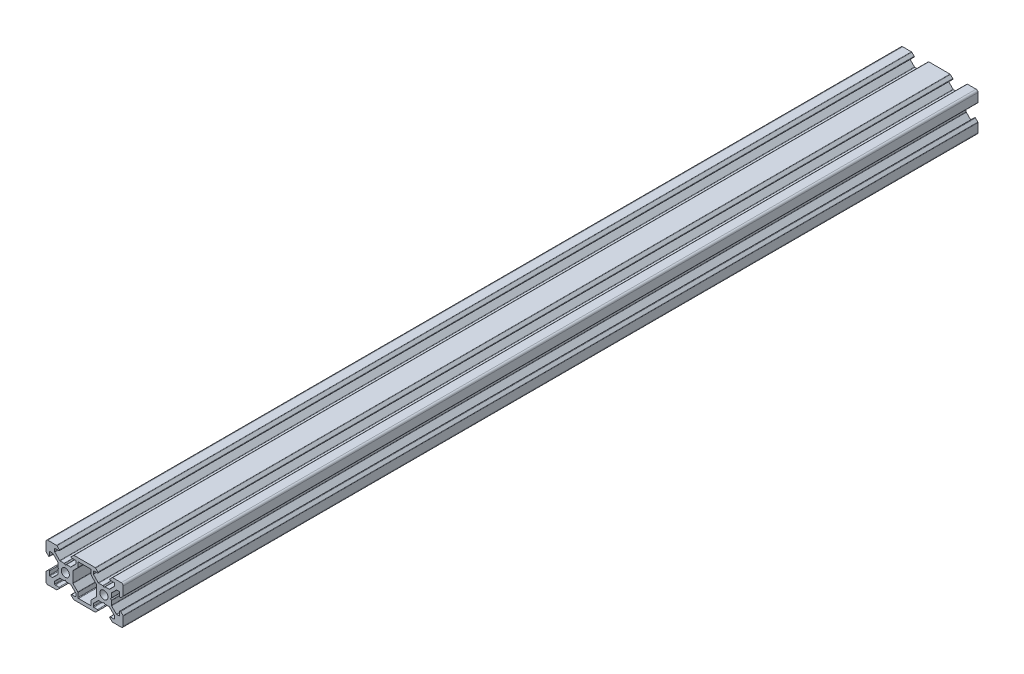
from build123d import *

# Parameters (mm, degrees)
SKETCH_1_R      = 2.1
EXTRUDE_1_DEPTH = 443
FILLET_1_R      = 1
FILLET_2_R      = 0.3


with BuildPart() as part:
    # Эскиз1 → Бобышка-Вытянуть1 (new body)
    with BuildSketch(Plane.XY):
        Polygon((-10, -10), (-10, -4.4), (-8.2, -2.6), (-8.2, -5.499339828), (-6.56, -5.499339828), (-3.900660172, -2.84), (-3.900660172, -0.5), (-3.400660172, 0), (-3.900660172, 0.5), (-3.900660172, 2.84), (-6.56, 5.499339828), (-8.2, 5.499339828), (-8.2, 2.6), (-10, 4.4), (-10, 10), (-4.4, 10), (-2.6, 8.2), (-5.499339828, 8.2), (-5.499339828, 6.56), (-2.84, 3.900660172), (-0.5, 3.900660172), (0, 3.400660172), (0.5, 3.900660172), (2.84, 3.900660172), (5.499339828, 6.56), (5.499339828, 8.2), (2.6, 8.2), (4.4, 10), (15.6, 10), (17.4, 8.2), (14.500660172, 8.2), (14.500660172, 6.56), (17.16, 3.900660172), (19.5, 3.900660172), (20, 3.400660172), (20.5, 3.900660172), (22.84, 3.900660172), (25.499339828, 6.56), (25.499339828, 8.2), (22.6, 8.2), (24.4, 10), (30, 10), (30, 4.4), (28.2, 2.6), (28.2, 5.499339828), (26.56, 5.499339828), (23.900660172, 2.84), (23.900660172, 0.5), (23.400660172, 0), (23.900660172, -0.5), (23.900660172, -2.84), (26.56, -5.499339828), (28.2, -5.499339828), (28.2, -2.6), (30, -4.4), (30, -10), (24.4, -10), (22.6, -8.2), (25.499339828, -8.2), (25.499339828, -6.56), (22.84, -3.900660172), (20.5, -3.900660172), (20, -3.400660172), (19.5, -3.900660172), (17.16, -3.900660172), (14.500660172, -6.56), (14.500660172, -8.2), (17.4, -8.2), (15.6, -10), (4.4, -10), (2.6, -8.2), (5.499339828, -8.2), (5.499339828, -6.56), (2.84, -3.900660172), (0.5, -3.900660172), (0, -3.400660172), (-0.5, -3.900660172), (-2.84, -3.900660172), (-5.499339828, -6.56), (-5.499339828, -8.2), (-2.6, -8.2), (-4.4, -10), align=None)
        Circle(SKETCH_1_R, mode=Mode.SUBTRACT)
        with Locations((20, 0)):
            Circle(SKETCH_1_R, mode=Mode.SUBTRACT)
        Polygon((3.900660172, -0.5), (3.900660172, 0.5), (3.900660172, 2.84), (6.56, 5.499339828), (6.56, 8.2), (13.44, 8.2), (13.44, 5.499339828), (16.099339828, 2.84), (16.099339828, 0.5), (16.099339828, -0.5), (16.099339828, -2.84), (13.44, -5.499339828), (13.44, -8.2), (6.56, -8.2), (6.56, -5.499339828), (3.900660172, -2.84), align=None, mode=Mode.SUBTRACT)
    extrude(amount=EXTRUDE_1_DEPTH)

    # Скругление1
    fillet_1_edges = [part.edges().sort_by_distance(p)[0] for p in [
        (-10, 10, 221.5),
        (-10, -10, 221.5),
        (30, 10, 221.5),
        (30, -10, 221.5),
    ]]
    fillet(fillet_1_edges, radius=FILLET_1_R)

    # Скругление2
    fillet_2_edges = [part.edges().sort_by_distance(p)[0] for p in [
        (-4.4, 10, 221.5),
        (-2.6, 8.2, 221.5),
        (-5.499339828, 8.2, 221.5),
        (-5.499339828, 6.56, 221.5),
        (-2.84, 3.900660172, 221.5),
        (-0.5, 3.900660172, 221.5),
        (0.5, 3.900660172, 221.5),
        (2.84, 3.900660172, 221.5),
        (5.499339828, 6.56, 221.5),
        (4.4, 10, 221.5),
        (5.499339828, 8.2, 221.5),
        (2.6, 8.2, 221.5),
        (3.900660172, 2.84, 221.5),
        (3.900660172, -2.84, 221.5),
        (4.4, -10, 221.5),
        (2.6, -8.2, 221.5),
        (5.499339828, -8.2, 221.5),
        (5.499339828, -6.56, 221.5),
        (2.84, -3.900660172, 221.5),
        (0.5, -3.900660172, 221.5),
        (-0.5, -3.900660172, 221.5),
        (-2.84, -3.900660172, 221.5),
        (-5.499339828, -6.56, 221.5),
        (-5.499339828, -8.2, 221.5),
        (-2.6, -8.2, 221.5),
        (-10, -4.4, 221.5),
        (-8.2, -2.6, 221.5),
        (-8.2, -5.499339828, 221.5),
        (-6.56, -5.499339828, 221.5),
        (-3.900660172, -2.84, 221.5),
        (-3.900660172, -0.5, 221.5),
        (-3.900660172, 0.5, 221.5),
        (-3.900660172, 2.84, 221.5),
        (-6.56, 5.499339828, 221.5),
        (-8.2, 5.499339828, 221.5),
        (-8.2, 2.6, 221.5),
        (-10, 4.4, 221.5),
        (6.56, -5.499339828, 221.5),
        (6.56, 5.499339828, 221.5),
        (6.56, 8.2, 221.5),
        (13.44, 8.2, 221.5),
        (13.44, 5.499339828, 221.5),
        (16.099339828, 2.84, 221.5),
        (16.099339828, -2.84, 221.5),
        (13.44, -5.499339828, 221.5),
        (13.44, -8.2, 221.5),
        (6.56, -8.2, 221.5),
        (15.6, 10, 221.5),
        (17.4, 8.2, 221.5),
        (14.500660172, 8.2, 221.5),
        (14.500660172, 6.56, 221.5),
        (17.16, 3.900660172, 221.5),
        (19.5, 3.900660172, 221.5),
        (20.5, 3.900660172, 221.5),
        (22.84, 3.900660172, 221.5),
        (25.499339828, 6.56, 221.5),
        (25.499339828, 8.2, 221.5),
        (22.6, 8.2, 221.5),
        (24.4, 10, 221.5),
        (30, 4.4, 221.5),
        (28.2, 2.6, 221.5),
        (28.2, 5.499339828, 221.5),
        (26.56, 5.499339828, 221.5),
        (23.900660172, 2.84, 221.5),
        (23.900660172, 0.5, 221.5),
        (23.900660172, -0.5, 221.5),
        (23.900660172, -2.84, 221.5),
        (26.56, -5.499339828, 221.5),
        (28.2, -5.499339828, 221.5),
        (28.2, -2.6, 221.5),
        (30, -4.4, 221.5),
        (24.4, -10, 221.5),
        (22.6, -8.2, 221.5),
        (25.499339828, -8.2, 221.5),
        (25.499339828, -6.56, 221.5),
        (22.84, -3.900660172, 221.5),
        (20.5, -3.900660172, 221.5),
        (19.5, -3.900660172, 221.5),
        (17.16, -3.900660172, 221.5),
        (14.500660172, -6.56, 221.5),
        (14.500660172, -8.2, 221.5),
        (17.4, -8.2, 221.5),
        (15.6, -10, 221.5),
    ]]
    fillet(fillet_2_edges, radius=FILLET_2_R)


solid = part.part
